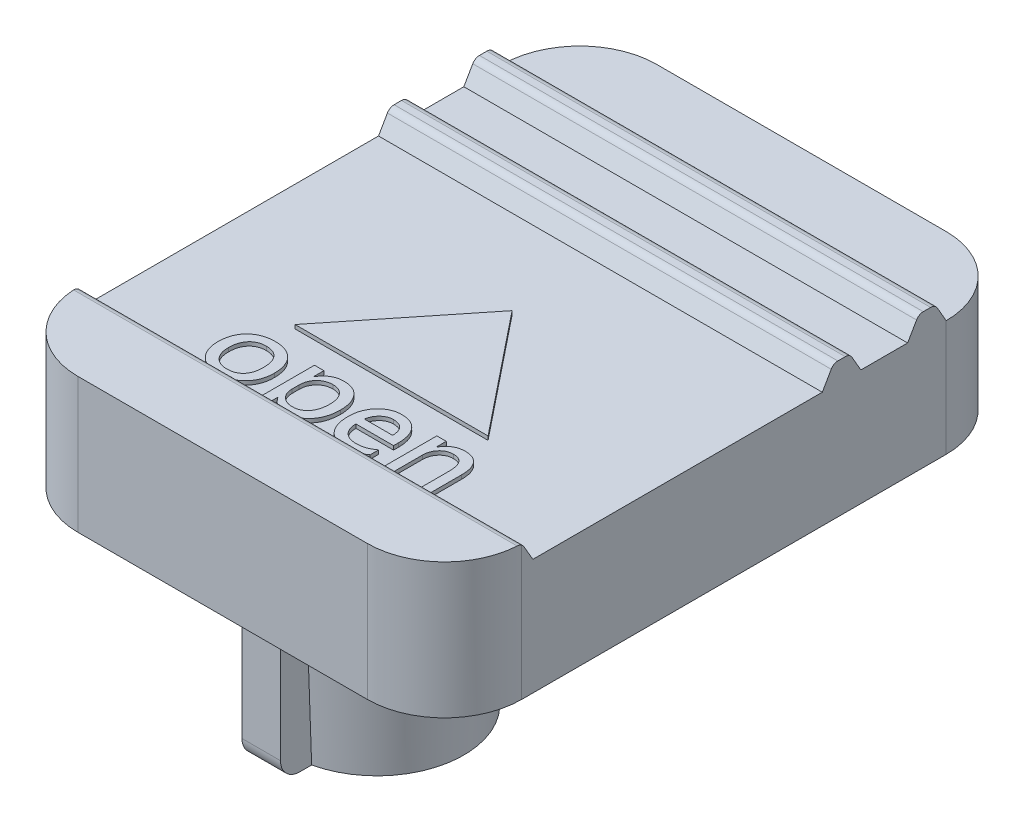
from build123d import *

# Parameters (mm, degrees)
SKETCH_1_W                   = 11.5
SKETCH_1_H                   = 15
EXTRUDE_1_DEPTH              = 3.5
FILLET_1_R                   = 2
CUT_EXTRUDE_1_DEPTH          = 5.75
FILLET_2_R                   = 0.2
EXTRUDE_2_DEPTH              = 0.1
EXTRUDE_3_DEPTH              = 0.1
SKETCH_8_W                   = 7.5
SKETCH_8_H                   = 13
CUT_EXTRUDE_2_DEPTH          = 1
SKETCH_10_R                  = 2.25
EXTRUDE_4_DEPTH              = 5
DRAFT_1_ANGLE                = 2
HOLE_WIZARD_M3_1_D           = 2.5
HOLE_WIZARD_M3_1_DEPTH       = 4
HOLE_WIZARD_M3_1_CSINK_D     = 3
HOLE_WIZARD_M3_1_CSINK_ANGLE = 90
HOLE_WIZARD_M3_1_TIP         = 0.751075774
RIB_START                    = -0.5
RIB_4_DEPTH                  = 1
RIB_6_DEPTH                  = 1
FILLET_3_R                   = 0.5


with BuildPart() as part:
    # 草图1 → 凸台-拉伸1 (new body)
    with BuildSketch(Plane(origin=(0, 0, 0), x_dir=(1, 0, 0), z_dir=(0, 1, 0))):
        Rectangle(SKETCH_1_W, SKETCH_1_H)
    extrude(amount=EXTRUDE_1_DEPTH)

    # 圆角1
    fillet_1_edges = [part.edges().sort_by_distance(p)[0] for p in [
        (5.75, 1.75, 7.5),
        (-5.75, 1.75, 7.5),
        (-5.75, 1.75, -7.5),
        (5.75, 1.75, -7.5),
    ]]
    fillet(fillet_1_edges, radius=FILLET_1_R)

    # 草图3 → 切除-拉伸1 (cut, symmetric)
    with BuildSketch(Plane(origin=(0, 0, 0), x_dir=(0, 0, -1), z_dir=(1, 0, 0))):
        Polygon((-5.5, 3.5), (-5.211324865, 3), (2.288675135, 3), (2.577350269, 3.5), align=None)
        Polygon((3, 3.5), (3.288675135, 3), (4.5, 3), (4.788675135, 3.5), align=None)
        Polygon((5.211324865, 3.5), (5.5, 3), (7.5, 3), (7.5, 3.5), align=None)
    extrude(amount=CUT_EXTRUDE_1_DEPTH, both=True, mode=Mode.SUBTRACT)

    # 圆角2
    fillet_2_edges = [part.edges().sort_by_distance(p)[0] for p in [
        (0, 3.5, 5.5),
        (0, 3.5, -2.577350269),
        (0, 3.5, -3),
        (0, 3.5, -4.788675135),
        (0, 3.5, -5.211324865),
    ]]
    fillet(fillet_2_edges, radius=FILLET_2_R)

    # 草图4 → 凸台-拉伸2 (add)
    with BuildSketch(Plane(origin=(0, 3, 0), x_dir=(1, 0, 0), z_dir=(0, 1, 0))):
        Polygon((0, 0), (-2.5, -3.122498999), (2.5, -3.122498999), align=None)
    extrude(amount=EXTRUDE_2_DEPTH)

    # 草图7 → 凸台-拉伸3 (add)
    # profile 1 of 4: a face of its own
    with BuildSketch(Plane(origin=(0, 3, 0), x_dir=(1, 0, 0), z_dir=(0, 1, 0))):
        with BuildLine():
            add(Edge.make_bspline(
                [(-3.11595942, -4.507333997), (-3.115433664, -4.479231226), (-3.114405122, -4.424253506), (-3.104647119, -4.344185678), (-3.089126176, -4.268671013), (-3.067537932, -4.197682194), (-3.039019696, -4.13139928), (-3.004887478, -4.069266271), (-2.963663057, -4.012201525), (-2.916773034, -3.959957228), (-2.864550533, -3.913003655), (-2.807464757, -3.872148047), (-2.746073001, -3.837019193), (-2.679870451, -3.808941043), (-2.609329846, -3.787241962), (-2.534447197, -3.771691877), (-2.455140357, -3.761936432), (-2.400668304, -3.760908376), (-2.372819176, -3.760382777)],
                knots=[0, 0, 0, 0, 1.130891478, 2.212373923, 3.241380589, 4.231321622, 5.19354654, 6.141244045, 7.079317473, 8.020841348, 8.962365223, 9.900438651, 10.841726407, 11.803951325, 12.789006411, 13.808002152, 14.87932938, 16, 16, 16, 16], degree=3))
            add(Edge.make_bspline(
                [(-2.372819176, -3.760382777), (-2.34636692, -3.7609247), (-2.294820878, -3.761980714), (-2.219740817, -3.77145111), (-2.148889571, -3.786114242), (-2.082274315, -3.806822374), (-2.020496561, -3.834666784), (-1.96301364, -3.867963686), (-1.909471177, -3.906902407), (-1.861341201, -3.952517312), (-1.817577397, -4.002831121), (-1.779826649, -4.058268495), (-1.748013628, -4.118429756), (-1.721666167, -4.18284433), (-1.701509977, -4.252101742), (-1.687071745, -4.325807449), (-1.678785241, -4.4042485), (-1.677562331, -4.458025916), (-1.67693503, -4.485611436)],
                knots=[0, 0, 0, 0, 1.113756326, 2.170314997, 3.181940078, 4.158355207, 5.102026982, 6.029850454, 6.952351345, 7.883578216, 8.816801288, 9.756231341, 10.70172166, 11.67844461, 12.682442287, 13.734942189, 14.838122004, 16, 16, 16, 16], degree=3))
            add(Edge.make_bspline(
                [(-1.67693503, -4.485611436), (-1.677505034, -4.512567373), (-1.678621585, -4.565369994), (-1.687814763, -4.642570158), (-1.703417366, -4.715665143), (-1.725200839, -4.784731291), (-1.753122656, -4.849861189), (-1.787101938, -4.911111114), (-1.827457721, -4.968360488), (-1.873779743, -5.021046264), (-1.925231381, -5.068689983), (-1.980949428, -5.110608325), (-2.04140043, -5.145348938), (-2.105866402, -5.174135041), (-2.174586281, -5.196569217), (-2.24759586, -5.21254359), (-2.324666227, -5.222212428), (-2.377490893, -5.223261838), (-2.404450274, -5.223797411)],
                knots=[0, 0, 0, 0, 1.106974384, 2.168396072, 3.187710748, 4.17289257, 5.138253725, 6.093578844, 7.044691026, 8.009713686, 8.969715493, 9.920412514, 10.867278638, 11.827266264, 12.815648618, 13.830975675, 14.893025616, 16, 16, 16, 16], degree=3))
            add(Edge.make_bspline(
                [(-2.404450274, -5.223797411), (-2.430770657, -5.223224765), (-2.482306284, -5.222103517), (-2.557625146, -5.212957689), (-2.628734598, -5.197199718), (-2.696051143, -5.176002591), (-2.759128723, -5.148036352), (-2.818193813, -5.113978391), (-2.873002322, -5.073699093), (-2.923315101, -5.027543001), (-2.968375388, -4.97631648), (-3.008008489, -4.920944317), (-3.041887212, -4.861721628), (-3.068596715, -4.79806379), (-3.09043976, -4.730993218), (-3.1047913, -4.6597476), (-3.114351616, -4.58482952), (-3.115415847, -4.533534029), (-3.11595942, -4.507333997)],
                knots=[0, 0, 0, 0, 1.109340584, 2.172102268, 3.192069327, 4.176030846, 5.142243327, 6.094750183, 7.04480012, 8.003728309, 8.96744442, 9.91554541, 10.870037285, 11.836887681, 12.8208492, 13.838564487, 14.896010537, 16, 16, 16, 16], degree=3))
        make_face()
        with BuildLine():
            add(Edge.make_bspline(
                [(-2.847666737, -4.499330948), (-2.847307954, -4.518398829), (-2.846607822, -4.555607993), (-2.840965429, -4.609817193), (-2.83096489, -4.660912652), (-2.817298564, -4.70884278), (-2.80021718, -4.753927256), (-2.778786589, -4.795758521), (-2.753037782, -4.834237752), (-2.724195497, -4.869841074), (-2.69172995, -4.901587553), (-2.656149788, -4.928943345), (-2.618271129, -4.952586359), (-2.577391655, -4.97113678), (-2.534073825, -4.986205896), (-2.487956345, -4.996792747), (-2.439164115, -5.002847545), (-2.405864469, -5.003798579), (-2.388825274, -5.004285216)],
                knots=[0, 0, 0, 0, 1.186433505, 2.31521262, 3.386501185, 4.422409794, 5.413365807, 6.382095459, 7.34021986, 8.289662896, 9.228815267, 10.158571698, 11.077817105, 12.000963171, 12.945952963, 13.927754231, 14.939646379, 16, 16, 16, 16], degree=3))
            add(Edge.make_bspline(
                [(-2.388825274, -5.004285216), (-2.371269963, -5.004014163), (-2.337047173, -5.003485764), (-2.287476812, -4.996651128), (-2.241033444, -4.986692116), (-2.198081984, -4.971953636), (-2.157937072, -4.953801964), (-2.121381056, -4.930724185), (-2.087779095, -4.903952909), (-2.058056929, -4.872663237), (-2.031115025, -4.838014654), (-2.008349219, -4.798987937), (-1.988520946, -4.756836343), (-1.972396018, -4.711013972), (-1.960373234, -4.661574883), (-1.951739548, -4.608569674), (-1.946326826, -4.552033534), (-1.945600749, -4.51318997), (-1.945227713, -4.493233387)],
                knots=[0, 0, 0, 0, 1.091675539, 2.128141218, 3.108232562, 4.043223565, 4.948740417, 5.843705042, 6.726470706, 7.61544466, 8.523064122, 9.451784335, 10.420813526, 11.418443159, 12.469161808, 13.582968635, 14.758206449, 16, 16, 16, 16], degree=3))
            add(Edge.make_bspline(
                [(-1.945227713, -4.493233387), (-1.945602231, -4.47314997), (-1.946331311, -4.434053227), (-1.951714175, -4.377260391), (-1.960361346, -4.324125088), (-1.972472448, -4.274590506), (-1.988435799, -4.228585274), (-2.008344126, -4.18632868), (-2.031215605, -4.147256801), (-2.058053995, -4.112300209), (-2.087661234, -4.080623397), (-2.121380485, -4.053820754), (-2.158032354, -4.030841258), (-2.19797763, -4.012128313), (-2.241048689, -3.997521057), (-2.287472407, -3.987519529), (-2.33704837, -3.980697014), (-2.371270368, -3.980166904), (-2.388825274, -3.979894972)],
                knots=[0, 0, 0, 0, 1.246690419, 2.426954276, 3.538083164, 4.586275558, 5.588946905, 6.555646248, 7.482133528, 8.393834498, 9.286368649, 10.167011869, 11.05982472, 11.966497605, 12.899240598, 13.876975497, 14.910949189, 16, 16, 16, 16], degree=3))
            add(Edge.make_bspline(
                [(-2.388825274, -3.979894972), (-2.40612443, -3.980332555), (-2.439832152, -3.981185193), (-2.488942226, -3.98786562), (-2.535390586, -3.998319738), (-2.579006447, -4.013771253), (-2.620120556, -4.033064741), (-2.658024356, -4.057449999), (-2.693313945, -4.085662415), (-2.725290621, -4.118337159), (-2.754440112, -4.154336604), (-2.779011173, -4.194435361), (-2.800767287, -4.237187987), (-2.817538517, -4.283661199), (-2.831539055, -4.332868296), (-2.840806717, -4.385479574), (-2.846661905, -4.441269948), (-2.8473257, -4.479625215), (-2.847666737, -4.499330948)],
                knots=[0, 0, 0, 0, 1.058687113, 2.062871248, 3.028742116, 3.968299712, 4.890116563, 5.802701825, 6.72090305, 7.650266932, 8.596399539, 9.550172127, 10.523993966, 11.527967281, 12.569520306, 13.652549532, 14.793953588, 16, 16, 16, 16], degree=3))
        make_face(mode=Mode.SUBTRACT)
    # profile 2 of 4: a face of its own
    with BuildSketch(Plane(origin=(0, 3, 0), x_dir=(1, 0, 0), z_dir=(0, 1, 0))):
        with BuildLine():
            Line((-1.091569176, -4.978370582), (-1.091569176, -5.857943753))
            Line((-1.091569176, -5.857943753), (-1.335471615, -5.857943753))
            Line((-1.335471615, -5.857943753), (-1.335471615, -3.784773021))
            Line((-1.335471615, -3.784773021), (-1.091569176, -3.784773021))
            Line((-1.091569176, -3.784773021), (-1.091569176, -4.050779118))
            Line((-1.091569176, -4.050779118), (-1.086233811, -4.050779118))
            add(Edge.make_bspline(
                [(-1.086233811, -4.050779118), (-1.071825516, -4.027628561), (-1.043829757, -3.982646316), (-0.993086535, -3.923485847), (-0.937919712, -3.87298846), (-0.877719804, -3.831286218), (-0.812117965, -3.799360327), (-0.74173933, -3.777056891), (-0.666584716, -3.762768276), (-0.614756039, -3.761192183), (-0.588139298, -3.760382777)],
                knots=[0, 0, 0, 0, 1.07810323, 2.094787777, 3.073712125, 4.031959813, 4.983268575, 5.950146044, 6.947292596, 8, 8, 8, 8], degree=3))
            add(Edge.make_bspline(
                [(-0.588139298, -3.760382777), (-0.565496122, -3.760955185), (-0.521430161, -3.76206915), (-0.457236682, -3.771111585), (-0.396721596, -3.785351758), (-0.339877448, -3.805990897), (-0.287105568, -3.832925307), (-0.23774952, -3.865185069), (-0.19213912, -3.903389361), (-0.151251481, -3.947861756), (-0.114191139, -3.996708715), (-0.081695662, -4.049722753), (-0.054515287, -4.10700478), (-0.032555167, -4.168349363), (-0.014832833, -4.233543158), (-0.003091684, -4.302861337), (0.005000488, -4.375917628), (0.005655795, -4.4260095), (0.005991799, -4.451693753)],
                knots=[0, 0, 0, 0, 1.054955033, 2.053051499, 3.015203125, 3.947977596, 4.864143478, 5.770615839, 6.690923877, 7.629318651, 8.580200794, 9.544863097, 10.522089646, 11.529728794, 12.578167428, 13.666440102, 14.803483672, 16, 16, 16, 16], degree=3))
            add(Edge.make_bspline(
                [(0.005991799, -4.451693753), (0.005529811, -4.480042825), (0.004626482, -4.535473973), (-0.003896075, -4.616523267), (-0.01795838, -4.693207586), (-0.037206508, -4.765931795), (-0.062987006, -4.833970744), (-0.093195648, -4.898320452), (-0.130378948, -4.95755562), (-0.171870283, -5.0127126), (-0.218402647, -5.062407698), (-0.269208277, -5.105752659), (-0.324114734, -5.142061968), (-0.38266277, -5.172260723), (-0.445261834, -5.195425043), (-0.511757578, -5.211708709), (-0.581982613, -5.221883143), (-0.630151504, -5.223148891), (-0.654831372, -5.223797411)],
                knots=[0, 0, 0, 0, 1.188087247, 2.323075642, 3.411408772, 4.453855081, 5.471636337, 6.457704693, 7.428587147, 8.397774093, 9.347140561, 10.276492702, 11.190709405, 12.10047976, 13.032254493, 13.98153135, 14.965815122, 16, 16, 16, 16], degree=3))
            add(Edge.make_bspline(
                [(-0.654831372, -5.223797411), (-0.677489784, -5.223088617), (-0.721837755, -5.221701335), (-0.786376566, -5.210151499), (-0.846644348, -5.190521704), (-0.90319122, -5.163590788), (-0.955481422, -5.128611512), (-1.004048156, -5.086246612), (-1.048202318, -5.035855379), (-1.073332107, -4.997871573), (-1.086233811, -4.978370582)],
                knots=[0, 0, 0, 0, 1.044186918, 2.043725318, 3.010571141, 3.958896111, 4.922187342, 5.901827956, 6.922792684, 8, 8, 8, 8], degree=3))
            Line((-1.086233811, -4.978370582), (-1.091569176, -4.978370582))
        make_face()
        with BuildLine():
            add(Edge.make_bspline(
                [(-1.092712469, -4.611373631), (-1.092335235, -4.624984214), (-1.091595418, -4.651676741), (-1.086098923, -4.690850803), (-1.077326605, -4.728358764), (-1.065266763, -4.764378301), (-1.048985101, -4.79847789), (-1.029462177, -4.831019345), (-1.006460511, -4.862124508), (-0.979946713, -4.891136016), (-0.950937931, -4.917666474), (-0.919577776, -4.940769421), (-0.886722028, -4.960747116), (-0.851550564, -4.976150942), (-0.815249937, -4.989124297), (-0.77684255, -4.99765448), (-0.736673763, -5.003175358), (-0.709220304, -5.003910517), (-0.695227713, -5.004285216)],
                knots=[0, 0, 0, 0, 1.04651673, 2.052386336, 3.035848767, 4.005972681, 4.967448941, 5.935898783, 6.920719053, 7.937395891, 8.954072729, 9.938892998, 10.929126002, 11.904254888, 12.88679486, 13.889290092, 14.92420474, 16, 16, 16, 16], degree=3))
            add(Edge.make_bspline(
                [(-0.695227713, -5.004285216), (-0.678685881, -5.003880492), (-0.646468806, -5.003092248), (-0.599484536, -4.995940517), (-0.555097403, -4.984834787), (-0.513787975, -4.968171213), (-0.475017531, -4.947435229), (-0.439309135, -4.921791832), (-0.406035225, -4.891750735), (-0.376215252, -4.85694082), (-0.34895562, -4.818460235), (-0.325729927, -4.775939705), (-0.306455087, -4.729823299), (-0.289894622, -4.680619936), (-0.277359528, -4.627678353), (-0.268852343, -4.571200823), (-0.263396111, -4.511251287), (-0.26267226, -4.470125762), (-0.262300884, -4.44902607)],
                knots=[0, 0, 0, 0, 0.997677617, 1.943089067, 2.86163638, 3.75280666, 4.624068763, 5.509018114, 6.399099569, 7.322942249, 8.269409922, 9.240398368, 10.239988683, 11.28243395, 12.370208899, 13.518437828, 14.726819993, 16, 16, 16, 16], degree=3))
            add(Edge.make_bspline(
                [(-0.262300884, -4.44902607), (-0.262510002, -4.431225984), (-0.262918799, -4.396429327), (-0.268534207, -4.345762667), (-0.276831161, -4.298006918), (-0.287990249, -4.253076653), (-0.303465402, -4.211493068), (-0.321647256, -4.172665832), (-0.343595128, -4.136942723), (-0.368692772, -4.104314917), (-0.396382463, -4.074732679), (-0.427172172, -4.049525764), (-0.4601219, -4.028013389), (-0.495517226, -4.010304021), (-0.53351646, -3.996591529), (-0.57399455, -3.98668008), (-0.61693787, -3.980951368), (-0.646303052, -3.980252253), (-0.66131003, -3.979894972)],
                knots=[0, 0, 0, 0, 1.226013109, 2.396682759, 3.507708646, 4.5650194, 5.581387303, 6.560272442, 7.515104231, 8.464059582, 9.392855952, 10.300708431, 11.199057894, 12.099452161, 13.021583285, 13.976976669, 14.966140734, 16, 16, 16, 16], degree=3))
            add(Edge.make_bspline(
                [(-0.66131003, -3.979894972), (-0.676702872, -3.980213958), (-0.706979498, -3.98084138), (-0.751248025, -3.987177541), (-0.793378911, -3.997008925), (-0.833437602, -4.010757042), (-0.871279359, -4.028858625), (-0.90721429, -4.050597486), (-0.94107661, -4.076268213), (-0.972010213, -4.106112251), (-1.000663643, -4.138433874), (-1.024894616, -4.17391555), (-1.046410637, -4.210949736), (-1.062797377, -4.250863688), (-1.076421543, -4.292582083), (-1.08580985, -4.336645031), (-1.091682271, -4.382936575), (-1.092364348, -4.414582027), (-1.092712469, -4.430733387)],
                knots=[0, 0, 0, 0, 1.055142017, 2.075389376, 3.060199554, 4.019076789, 4.973907943, 5.93171582, 6.895370789, 7.881413521, 8.875621505, 9.852071251, 10.823610854, 11.807495604, 12.804943363, 13.830311844, 14.892623976, 16, 16, 16, 16], degree=3))
            Line((-1.092712469, -4.430733387), (-1.092712469, -4.611373631))
        make_face(mode=Mode.SUBTRACT)
    # profile 3 of 4: a face of its own
    with BuildSketch(Plane(origin=(0, 3, 0), x_dir=(1, 0, 0), z_dir=(0, 1, 0))):
        with BuildLine():
            Line((1.493796677, -4.565260826), (0.518186921, -4.565260826))
            add(Edge.make_bspline(
                [(0.518186921, -4.565260826), (0.519048873, -4.582309474), (0.520727704, -4.615515293), (0.527862907, -4.663622244), (0.537400856, -4.708907789), (0.551359849, -4.751066363), (0.568368561, -4.790487559), (0.589123462, -4.826773707), (0.612776853, -4.860405948), (0.640338888, -4.890427434), (0.670975341, -4.917325369), (0.704703671, -4.940529519), (0.741094027, -4.960645191), (0.780614397, -4.976434465), (0.822772679, -4.989236049), (0.867889978, -4.997699559), (0.915789924, -5.003205053), (0.948683897, -5.003918445), (0.965595458, -5.004285216)],
                knots=[0, 0, 0, 0, 1.155037836, 2.24967847, 3.288857768, 4.284266915, 5.250950835, 6.190748599, 7.109533749, 8.028801791, 8.943027185, 9.863903043, 10.795320882, 11.751967553, 12.739656042, 13.77359062, 14.855350881, 16, 16, 16, 16], degree=3))
            add(Edge.make_bspline(
                [(0.965595458, -5.004285216), (0.984928387, -5.003882068), (1.023477342, -5.003078211), (1.080568422, -4.995488897), (1.13659442, -4.983809703), (1.191115251, -4.966895698), (1.244552223, -4.945407107), (1.296614819, -4.919036067), (1.347756836, -4.888161633), (1.379916701, -4.864070729), (1.396235702, -4.851846192)],
                knots=[0, 0, 0, 0, 0.996200866, 1.9863779, 2.963825737, 3.943640067, 4.925028889, 5.929589628, 6.949403955, 8, 8, 8, 8], degree=3))
            Line((1.396235702, -4.851846192), (1.396235702, -5.071358387))
            add(Edge.make_bspline(
                [(1.396235702, -5.071358387), (1.380367028, -5.083686025), (1.348427563, -5.108498315), (1.295323818, -5.138883101), (1.239050234, -5.165665199), (1.178622891, -5.186644492), (1.114716838, -5.203651839), (1.046848832, -5.215170741), (0.975292147, -5.222663696), (0.926235223, -5.223414235), (0.90118997, -5.223797411)],
                knots=[0, 0, 0, 0, 0.911679366, 1.834970638, 2.771952977, 3.739182402, 4.735657767, 5.772494471, 6.862781534, 8, 8, 8, 8], degree=3))
            add(Edge.make_bspline(
                [(0.90118997, -5.223797411), (0.876259563, -5.223255211), (0.82762046, -5.222197381), (0.756855221, -5.212711078), (0.690237275, -5.198200714), (0.627902914, -5.177008254), (0.569661216, -5.149948324), (0.515697885, -5.116664703), (0.466042929, -5.077305383), (0.420732728, -5.032371299), (0.38025786, -4.982041743), (0.345459279, -4.926511448), (0.315541085, -4.866620211), (0.291794388, -4.801684202), (0.272499527, -4.732552346), (0.259505606, -4.658646672), (0.251296261, -4.580183334), (0.250370339, -4.526283555), (0.249894238, -4.498568753)],
                knots=[0, 0, 0, 0, 1.081901168, 2.110783998, 3.09425856, 4.03782829, 4.963102984, 5.876882109, 6.78389519, 7.708183099, 8.641884802, 9.581383782, 10.548263691, 11.543009434, 12.578669834, 13.66048665, 14.79704238, 16, 16, 16, 16], degree=3))
            add(Edge.make_bspline(
                [(0.249894238, -4.498568753), (0.250476374, -4.472372537), (0.251618573, -4.420973439), (0.260693645, -4.345670484), (0.274698433, -4.273682667), (0.296144432, -4.205650124), (0.322222748, -4.14072419), (0.354944628, -4.079600906), (0.393025706, -4.021661218), (0.437237692, -3.968397362), (0.485232, -3.919664234), (0.536887978, -3.87721208), (0.591313033, -3.8409907), (0.648750732, -3.811556047), (0.708940237, -3.788568672), (0.771894685, -3.7720193), (0.837889405, -3.762474053), (0.882866796, -3.761088242), (0.905763141, -3.760382777)],
                knots=[0, 0, 0, 0, 1.139115483, 2.235036935, 3.294842947, 4.32426707, 5.332913185, 6.334009026, 7.334738825, 8.343611937, 9.339938736, 10.305657042, 11.246619483, 12.178272258, 13.10697094, 14.043787257, 15.004163625, 16, 16, 16, 16], degree=3))
            add(Edge.make_bspline(
                [(0.905763141, -3.760382777), (0.928275303, -3.760834176), (0.972068542, -3.761712289), (1.035904418, -3.770298698), (1.095880966, -3.784377131), (1.152270424, -3.80363908), (1.204647815, -3.829126622), (1.253198423, -3.860121605), (1.298201561, -3.896566803), (1.338934447, -3.938682585), (1.375496796, -3.985545917), (1.407519381, -4.037071585), (1.43389891, -4.093389646), (1.456260473, -4.153716621), (1.472846362, -4.218786924), (1.48480003, -4.288107957), (1.492797461, -4.361950594), (1.493457511, -4.412672877), (1.493796677, -4.438736436)],
                knots=[0, 0, 0, 0, 1.061193466, 2.064355166, 3.030670548, 3.962806659, 4.868422573, 5.77082278, 6.67370011, 7.59302321, 8.5277546, 9.472036007, 10.447426708, 11.455727004, 12.501916844, 13.608960059, 14.771368247, 16, 16, 16, 16], degree=3))
            Line((1.493796677, -4.438736436), (1.493796677, -4.565260826))
        make_face()
        with BuildLine():
            add(Edge.make_bspline(
                [(1.249894238, -4.345748631), (1.249621009, -4.331635026), (1.249087806, -4.304092527), (1.244374789, -4.26395831), (1.237073255, -4.226312692), (1.227975293, -4.190832863), (1.214580792, -4.158429326), (1.199560421, -4.128109951), (1.181447334, -4.100313661), (1.160444952, -4.075278848), (1.137204765, -4.052622945), (1.111474722, -4.033061259), (1.083542362, -4.016653666), (1.053352417, -4.003225797), (1.020995839, -3.992396528), (0.986141129, -3.985543472), (0.949219195, -3.980646145), (0.923819562, -3.980150596), (0.910717409, -3.979894972)],
                knots=[0, 0, 0, 0, 1.195565537, 2.333129304, 3.418200415, 4.444387765, 5.429796768, 6.382931581, 7.308436984, 8.233190962, 9.146662802, 10.053004003, 10.964952543, 11.885185084, 12.848476637, 13.849111745, 14.890485264, 16, 16, 16, 16], degree=3))
            add(Edge.make_bspline(
                [(0.910717409, -3.979894972), (0.898500758, -3.980128926), (0.87447043, -3.980589117), (0.839212365, -3.985989926), (0.805045934, -3.99334634), (0.772176555, -4.004428362), (0.740772252, -4.019135785), (0.710533426, -4.036727718), (0.681494008, -4.057440381), (0.653762421, -4.080958754), (0.628011582, -4.107112972), (0.604635795, -4.135400422), (0.584023291, -4.165735404), (0.565614183, -4.197939133), (0.549594927, -4.23202389), (0.536678629, -4.268344471), (0.525979557, -4.306298124), (0.520804621, -4.332496426), (0.518186921, -4.345748631)],
                knots=[0, 0, 0, 0, 1.000596271, 1.968187343, 2.91813296, 3.863271592, 4.804443264, 5.756441586, 6.727333404, 7.724727238, 8.733580774, 9.732278533, 10.728802135, 11.736311071, 12.770589611, 13.811557169, 14.892993416, 16, 16, 16, 16], degree=3))
            Line((0.518186921, -4.345748631), (1.249894238, -4.345748631))
        make_face(mode=Mode.SUBTRACT)
    # profile 4 of 4: a face of its own
    with BuildSketch(Plane(origin=(0, 3, 0), x_dir=(1, 0, 0), z_dir=(0, 1, 0))):
        with BuildLine():
            Line((3.030382043, -5.199407167), (2.786479604, -5.199407167))
            Line((2.786479604, -5.199407167), (2.786479604, -4.408629728))
            add(Edge.make_bspline(
                [(2.786479604, -4.408629728), (2.786295362, -4.391346963), (2.785937229, -4.357752469), (2.782180168, -4.309115807), (2.775599503, -4.263839838), (2.767090917, -4.221849114), (2.755600562, -4.183092122), (2.741687189, -4.147688704), (2.725052913, -4.115746948), (2.706549703, -4.086716547), (2.68459501, -4.061614465), (2.660462843, -4.039478333), (2.633447093, -4.021289828), (2.604393948, -4.005655644), (2.572295839, -3.994421075), (2.537950291, -3.986156549), (2.50109577, -3.980480708), (2.475653316, -3.980094122), (2.462546677, -3.979894972)],
                knots=[0, 0, 0, 0, 1.353175533, 2.630322555, 3.816234572, 4.934111708, 5.982182561, 6.977817447, 7.907673264, 8.798840415, 9.666319876, 10.511439198, 11.355738527, 12.210057489, 13.087968395, 14.009593818, 14.974645454, 16, 16, 16, 16], degree=3))
            add(Edge.make_bspline(
                [(2.462546677, -3.979894972), (2.448806581, -3.980240551), (2.421964191, -3.980915667), (2.382616944, -3.98681728), (2.345265995, -3.996408264), (2.309396407, -4.009194209), (2.275889569, -4.026680365), (2.243796144, -4.04723378), (2.214227757, -4.072305161), (2.186351861, -4.100338609), (2.161505422, -4.1315788), (2.13911237, -4.164608611), (2.120929147, -4.200088106), (2.105441241, -4.237207448), (2.093685632, -4.276567715), (2.085500452, -4.317922774), (2.079764857, -4.361214065), (2.079366274, -4.390825563), (2.079162531, -4.405962045)],
                knots=[0, 0, 0, 0, 1.027264793, 2.006844835, 2.967815906, 3.908659698, 4.847774702, 5.788618494, 6.753340077, 7.740996995, 8.741143461, 9.734633229, 10.720597661, 11.717534537, 12.739556912, 13.786796657, 14.868678881, 16, 16, 16, 16], degree=3))
            Line((2.079162531, -4.405962045), (2.079162531, -5.199407167))
            Line((2.079162531, -5.199407167), (1.835260092, -5.199407167))
            Line((1.835260092, -5.199407167), (1.835260092, -3.784773021))
            Line((1.835260092, -3.784773021), (2.079162531, -3.784773021))
            Line((2.079162531, -3.784773021), (2.079162531, -4.040489484))
            Line((2.079162531, -4.040489484), (2.084497897, -4.040489484))
            add(Edge.make_bspline(
                [(2.084497897, -4.040489484), (2.098065223, -4.018270474), (2.124531173, -3.974927577), (2.172139264, -3.917708509), (2.223951741, -3.868722757), (2.28095177, -3.829387927), (2.341999826, -3.797820066), (2.408060596, -3.776398742), (2.478342892, -3.762403855), (2.526882025, -3.761066971), (2.551723506, -3.760382777)],
                knots=[0, 0, 0, 0, 1.088416816, 2.123188115, 3.105039773, 4.063757687, 5.012531063, 5.970909814, 6.961547054, 8, 8, 8, 8], degree=3))
            add(Edge.make_bspline(
                [(2.551723506, -3.760382777), (2.570669096, -3.760812911), (2.607547906, -3.761650195), (2.661111572, -3.768385514), (2.71102545, -3.780506729), (2.757816251, -3.796112454), (2.800823284, -3.817403295), (2.840406227, -3.843048432), (2.87645598, -3.873427255), (2.909071504, -3.908265776), (2.937561677, -3.947737698), (2.962529756, -3.991312253), (2.98392487, -4.038987383), (3.000907334, -4.091171355), (3.014208988, -4.147392248), (3.023607299, -4.2079125), (3.029357072, -4.272593037), (3.03003433, -4.317153982), (3.030382043, -4.340032167)],
                knots=[0, 0, 0, 0, 1.061495849, 2.066270034, 3.017604185, 3.936066276, 4.824265851, 5.698927154, 6.572979956, 7.459380659, 8.366350765, 9.2943081, 10.269316133, 11.28903267, 12.364683212, 13.503376758, 14.718200215, 16, 16, 16, 16], degree=3))
            Line((3.030382043, -4.340032167), (3.030382043, -5.199407167))
        make_face()
    extrude(amount=EXTRUDE_3_DEPTH)

    # 草图8 → 切除-拉伸2 (cut)
    with BuildSketch(Plane(origin=(0, 0, 0), x_dir=(1, 0, 0), z_dir=(0, 1, 0))):
        Rectangle(SKETCH_8_W, SKETCH_8_H)
    extrude(amount=CUT_EXTRUDE_2_DEPTH, mode=Mode.SUBTRACT)

    # 草图10 → 凸台-拉伸4 (add)
    with BuildSketch(Plane.XZ.offset(-1)):
        with Locations(Location((0, 3.5, 0), (0, 0, 270))):
            Circle(SKETCH_10_R)
    extrude(amount=EXTRUDE_4_DEPTH)

    # 拔模1
    draft_1_faces = [part.faces().sort_by_distance(p)[0] for p in [
        (0, -1.5, 5.75),
    ]]
    draft(draft_1_faces, Plane(origin=(0, -4, 3.5), x_dir=(0, 0, -1), z_dir=(0, -1, 0)), DRAFT_1_ANGLE)

    # M3 螺纹孔1
    with Locations(Plane(origin=(0, -4, 0), x_dir=(-1, 0, 0), z_dir=(0, -1, 0))):
        with Locations((0, -3.5)):
            CounterSinkHole(HOLE_WIZARD_M3_1_D / 2, HOLE_WIZARD_M3_1_CSINK_D / 2, depth=HOLE_WIZARD_M3_1_DEPTH, counter_sink_angle=HOLE_WIZARD_M3_1_CSINK_ANGLE)
            with Locations((0, 0, -(HOLE_WIZARD_M3_1_DEPTH + HOLE_WIZARD_M3_1_TIP / 2))):  # 118° drill point
                Cone(0, HOLE_WIZARD_M3_1_D / 2, HOLE_WIZARD_M3_1_TIP, mode=Mode.SUBTRACT)

    # 筋4: read off the stored shape, not the designer's step
    # 筋4 outline → 筋4 (add)
    with BuildSketch(Plane(origin=(0, 0, 0), x_dir=(0, 0, -1), z_dir=(1, 0, 0)).offset(RIB_START)):
        with BuildLine():
            Line((-6.5, 1), (-6.5, -4))
            Line((-6.5, -4), (-5.693740502, -3.999999979))
            add(Edge.make_bspline(
                [(-5.693740502, -3.999999979), (-5.701030776, -3.796459399), (-5.708319261, -3.592918754), (-5.767953166, -1.927162444), (-5.820210094, -0.46494361), (-5.872424185, 0.998185274), (-5.872456566, 0.999092637), (-5.872488946, 1)],
                knots=[3.778443656, 3.778443656, 3.778443656, 3.778443656, 4.389456949, 4.389456949, 8.778913895, 8.778913895, 8.781637717, 8.781637717, 8.781637717, 8.781637717], degree=3))
            Line((-5.872488946, 1), (-6.5, 1))
        make_face()
    extrude(amount=RIB_4_DEPTH)

    # 筋6: read off the stored shape, not the designer's step
    # 筋6 outline → 筋6 (add)
    with BuildSketch(Plane(origin=(0, 0, 0), x_dir=(0, 0, -1), z_dir=(1, 0, 0)).offset(RIB_START)):
        with BuildLine():
            Line((5.5, 0), (6.5, 1))
            Line((6.5, 1), (-1.127511053, 1))
            add(Edge.make_bspline(
                [(-1.306259498, -3.999999979), (-1.298966372, -3.796379781), (-1.291675037, -3.592759519), (-1.232038103, -1.926918222), (-1.179780995, -0.464694018), (-1.127569749, 0.998355249), (-1.127540401, 0.999177624), (-1.127511053, 1)],
                knots=[3.77822077, 3.77822077, 3.77822077, 3.77822077, 4.389473068, 4.389473068, 8.778946133, 8.778946133, 8.781414831, 8.781414831, 8.781414831, 8.781414831], degree=3))
            Line((-1.306259498, -3.999999979), (-0.25, -4))
            Line((-0.25, -4), (-0.25, 0))
            Line((-0.25, 0), (5.5, 0))
        make_face()
    extrude(amount=RIB_6_DEPTH)

    # 圆角3
    fillet_3_edges = [part.edges().sort_by_distance(p)[0] for p in [
        (0, -4, 6.5),
        (0, -4, 0.25),
    ]]
    fillet(fillet_3_edges, radius=FILLET_3_R)


solid = part.part
